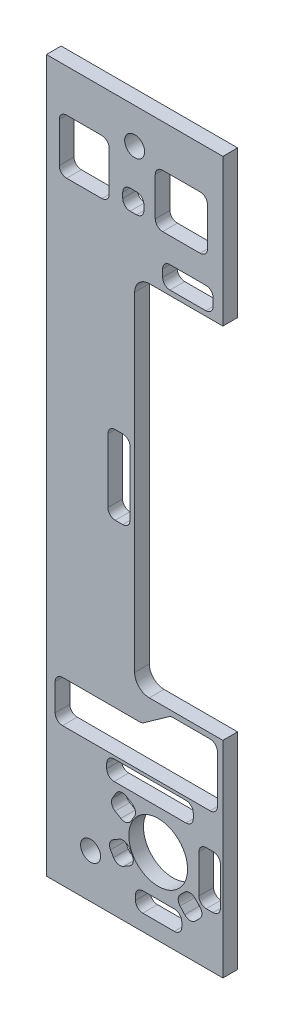
from build123d import *

# Parameters (mm, degrees)
BOSS_EXTRUDE1_DEPTH        = 3.175
F_6_CLEARANCE_HOLE1_D      = 4.3053
F_1_2_0_5_DIAMETER_HOLE1_D = 12.7
CUT_EXTRUDE1_DEPTH         = 159.354537431


with BuildPart() as part:
    # Sketch1 → Boss-Extrude1 (new body)
    with BuildSketch(Plane.XY):
        with BuildLine():
            Line((0, 0), (0, 44.45))
            Line((0, 44.45), (-15.875, 44.45))
            ThreePointArc((-15.875, 44.45), (-18.12006403, 45.37993597), (-19.05, 47.625))
            Line((-19.05, 47.625), (-19.05, 118.745))
            ThreePointArc((-19.05, 118.745), (-18.12006403, 120.99006403), (-15.875, 121.92))
            Line((-15.875, 121.92), (0, 121.92))
            Line((0, 121.92), (0, 153.67))
            Line((0, 153.67), (-38.1, 153.67))
            Line((-38.1, 153.67), (-38.1, 0))
            Line((-38.1, 0), (0, 0))
        make_face()
    extrude(amount=BOSS_EXTRUDE1_DEPTH)

    # #6 Clearance Hole1 (through all)
    with Locations(Plane(origin=(0, 0, 0), x_dir=(-1, 0, 0), z_dir=(0, 0, -1))):
        with Locations((28.575, 9.525), (19.05, 146.05)):
            Hole(F_6_CLEARANCE_HOLE1_D / 2)

    # 1/2 (0.5) Diameter Hole1 (through all)
    with Locations(Plane(origin=(0, 0, 0), x_dir=(-1, 0, 0), z_dir=(0, 0, -1))):
        with Locations((13.97, 16.51)):
            Hole(F_1_2_0_5_DIAMETER_HOLE1_D / 2)

    # Sketch6 → Cut-Extrude1 (cut, through all)
    with BuildSketch(Plane(origin=(0, 0, 0), x_dir=(-1, 0, 0), z_dir=(0, 0, -1))):
        with BuildLine():
            Line((2.086095691, 126.12437394), (2.086095691, 124.54355915))
            ThreePointArc((2.086095691, 124.54355915), (2.551063676, 123.421027135), (3.673595691, 122.95605915))
            Line((3.673595691, 122.95605915), (11.415583391, 122.95605915))
            ThreePointArc((11.415583391, 122.95605915), (12.538115406, 123.421027135), (13.003083391, 124.54355915))
            Line((13.003083391, 124.54355915), (13.003083391, 126.12437394))
            ThreePointArc((13.003083391, 126.12437394), (12.538115406, 127.246905955), (11.415583391, 127.71187394))
            Line((11.415583391, 127.71187394), (3.673595691, 127.71187394))
            ThreePointArc((3.673595691, 127.71187394), (2.551063676, 127.246905955), (2.086095691, 126.12437394))
        make_face()
        with BuildLine():
            Line((20.033703278, 89.369187567), (20.033703278, 75.581424323))
            ThreePointArc((20.033703278, 75.581424323), (20.498671263, 74.458892308), (21.621203278, 73.993924323))
            Line((21.621203278, 73.993924323), (23.241936694, 73.993924323))
            ThreePointArc((23.241936694, 73.993924323), (24.364468709, 74.458892308), (24.829436694, 75.581424323))
            Line((24.829436694, 75.581424323), (24.829436694, 89.369187567))
            ThreePointArc((24.829436694, 89.369187567), (24.364468709, 90.491719582), (23.241936694, 90.956687567))
            Line((23.241936694, 90.956687567), (21.621203278, 90.956687567))
            ThreePointArc((21.621203278, 90.956687567), (20.498671263, 90.491719582), (20.033703278, 89.369187567))
        make_face()
        with BuildLine():
            Line((2.759594469, 43.321454641), (10.76708766, 43.321454641))
            ThreePointArc((10.76708766, 43.321454641), (11.250343379, 43.246112093), (11.687728589, 43.027235945))
            Line((11.687728589, 43.027235945), (17.051636407, 39.208860888))
            ThreePointArc((17.051636407, 39.208860888), (17.489021617, 38.98998474), (17.972277336, 38.914642192))
            Line((17.972277336, 38.914642192), (34.627683239, 38.914642192))
            ThreePointArc((34.627683239, 38.914642192), (35.750215254, 38.449674207), (36.215183239, 37.327142192))
            Line((36.215183239, 37.327142192), (36.215183239, 31.47925594))
            ThreePointArc((36.215183239, 31.47925594), (35.750215254, 30.356723925), (34.627683239, 29.89175594))
            Line((34.627683239, 29.89175594), (2.759594469, 29.89175594))
            ThreePointArc((2.759594469, 29.89175594), (1.637062454, 30.356723925), (1.172094469, 31.47925594))
            Line((1.172094469, 31.47925594), (1.172094469, 41.733954641))
            ThreePointArc((1.172094469, 41.733954641), (1.637062454, 42.856486656), (2.759594469, 43.321454641))
        make_face()
        with BuildLine():
            Line((23.496317308, 29.23518518), (7.981217757, 29.23518518))
            ThreePointArc((7.981217757, 29.23518518), (6.858685741, 28.770217195), (6.393717757, 27.64768518))
            Line((6.393717757, 27.64768518), (6.393717757, 26.597597051))
            ThreePointArc((6.393717757, 26.597597051), (6.858685741, 25.475065036), (7.981217757, 25.010097051))
            Line((7.981217757, 25.010097051), (23.496317308, 25.010097051))
            ThreePointArc((23.496317308, 25.010097051), (24.618849324, 25.475065036), (25.083817308, 26.597597051))
            Line((25.083817308, 26.597597051), (25.083817308, 27.64768518))
            ThreePointArc((25.083817308, 27.64768518), (24.618849324, 28.770217195), (23.496317308, 29.23518518))
        make_face()
        with BuildLine():
            Line((2.113882863, 22.586241269), (3.592384956, 22.586241269))
            ThreePointArc((3.592384956, 22.586241269), (4.714916971, 22.121273284), (5.179884956, 20.998741269))
            Line((5.179884956, 20.998741269), (5.179884956, 12.755613209))
            ThreePointArc((5.179884956, 12.755613209), (4.714916971, 11.633081194), (3.592384956, 11.168113209))
            Line((3.592384956, 11.168113209), (2.113882863, 11.168113209))
            ThreePointArc((2.113882863, 11.168113209), (0.991350848, 11.633081194), (0.526382863, 12.755613209))
            Line((0.526382863, 12.755613209), (0.526382863, 20.998741269))
            ThreePointArc((0.526382863, 20.998741269), (0.991350848, 22.121273284), (2.113882863, 22.586241269))
        make_face()
        with BuildLine():
            Line((18.879806488, 6.08183183), (18.879806488, 5.073926227))
            ThreePointArc((18.879806488, 5.073926227), (18.414838503, 3.951394212), (17.292306488, 3.486426227))
            Line((17.292306488, 3.486426227), (10.463932238, 3.486426227))
            ThreePointArc((10.463932238, 3.486426227), (9.341400223, 3.951394212), (8.876432238, 5.073926227))
            Line((8.876432238, 5.073926227), (8.876432238, 6.08183183))
            ThreePointArc((8.876432238, 6.08183183), (9.341400223, 7.204363845), (10.463932238, 7.66933183))
            Line((10.463932238, 7.66933183), (17.292306488, 7.66933183))
            ThreePointArc((17.292306488, 7.66933183), (18.414838503, 7.204363845), (18.879806488, 6.08183183))
        make_face()
        with BuildLine():
            Line((6.030987626, 11.925319997), (4.983176412, 10.877508783))
            ThreePointArc((4.983176412, 10.877508783), (4.518208427, 9.754976767), (4.983176412, 8.632444752))
            Line((4.983176412, 8.632444752), (5.943333194, 7.67228797))
            ThreePointArc((5.943333194, 7.67228797), (7.110275776, 7.207941303), (8.249421661, 7.736826424))
            Line((8.249421661, 7.736826424), (9.238538577, 8.843331936))
            ThreePointArc((9.238538577, 8.843331936), (9.641860808, 9.945736065), (9.177514141, 11.023857513))
            Line((9.177514141, 11.023857513), (8.276051657, 11.925319997))
            ThreePointArc((8.276051657, 11.925319997), (7.153519641, 12.390287982), (6.030987626, 11.925319997))
        make_face()
        with BuildLine():
            Line((20.203743496, 14.211835085), (19.550583224, 13.090409141))
            ThreePointArc((19.550583224, 13.090409141), (19.387406634, 11.88639637), (20.123388956, 10.919647502))
            Line((20.123388956, 10.919647502), (21.439156716, 10.153295312))
            ThreePointArc((21.439156716, 10.153295312), (22.643169487, 9.990118723), (23.609918355, 10.726101045))
            Line((23.609918355, 10.726101045), (24.263078627, 11.847526988))
            ThreePointArc((24.263078627, 11.847526988), (24.426255216, 13.051539759), (23.690272894, 14.018288627))
            Line((23.690272894, 14.018288627), (22.374505134, 14.784640817))
            ThreePointArc((22.374505134, 14.784640817), (21.170492364, 14.947817407), (20.203743496, 14.211835085))
        make_face()
        with BuildLine():
            Line((19.098011702, 20.675012055), (19.85485139, 19.39515307))
            ThreePointArc((19.85485139, 19.39515307), (20.826455949, 18.665592974), (22.029361012, 18.836744254))
            Line((22.029361012, 18.836744254), (23.273160379, 19.572260226))
            ThreePointArc((23.273160379, 19.572260226), (24.002720475, 20.543864785), (23.831569194, 21.746769848))
            Line((23.831569194, 21.746769848), (23.074729506, 23.026628833))
            ThreePointArc((23.074729506, 23.026628833), (22.103124948, 23.756188929), (20.900219884, 23.585037649))
            Line((20.900219884, 23.585037649), (19.656420517, 22.849521677))
            ThreePointArc((19.656420517, 22.849521677), (18.926860421, 21.877917118), (19.098011702, 20.675012055))
        make_face()
        with BuildLine():
            Line((4.907288518, 144.565417771), (13.015464629, 144.565417771))
            ThreePointArc((13.015464629, 144.565417771), (14.137996644, 144.100449786), (14.602964629, 142.977917771))
            Line((14.602964629, 142.977917771), (14.602964629, 134.67957577))
            ThreePointArc((14.602964629, 134.67957577), (14.137996644, 133.557043755), (13.015464629, 133.09207577))
            Line((13.015464629, 133.09207577), (4.907288518, 133.09207577))
            ThreePointArc((4.907288518, 133.09207577), (3.784756502, 133.557043755), (3.319788518, 134.67957577))
            Line((3.319788518, 134.67957577), (3.319788518, 142.977917771))
            ThreePointArc((3.319788518, 142.977917771), (3.784756502, 144.100449786), (4.907288518, 144.565417771))
        make_face()
        with BuildLine():
            Line((18.639136407, 137.719445748), (20.033703278, 137.719445748))
            ThreePointArc((20.033703278, 137.719445748), (21.156235293, 137.254477763), (21.621203278, 136.131945748))
            Line((21.621203278, 136.131945748), (21.621203278, 134.996518919))
            ThreePointArc((21.621203278, 134.996518919), (21.156235293, 133.873986904), (20.033703278, 133.409018919))
            Line((20.033703278, 133.409018919), (18.639136407, 133.409018919))
            ThreePointArc((18.639136407, 133.409018919), (17.516604392, 133.873986904), (17.051636407, 134.996518919))
            Line((17.051636407, 134.996518919), (17.051636407, 136.131945748))
            ThreePointArc((17.051636407, 136.131945748), (17.516604392, 137.254477763), (18.639136407, 137.719445748))
        make_face()
        with BuildLine():
            Line((26.142479513, 144.502029141), (33.743546585, 144.502029141))
            ThreePointArc((33.743546585, 144.502029141), (34.8660786, 144.037061156), (35.331046585, 142.914529141))
            Line((35.331046585, 142.914529141), (35.331046585, 134.299243991))
            ThreePointArc((35.331046585, 134.299243991), (34.8660786, 133.176711976), (33.743546585, 132.711743991))
            Line((33.743546585, 132.711743991), (26.142479513, 132.711743991))
            ThreePointArc((26.142479513, 132.711743991), (25.019947498, 133.176711976), (24.554979513, 134.299243991))
            Line((24.554979513, 134.299243991), (24.554979513, 142.914529141))
            ThreePointArc((24.554979513, 142.914529141), (25.019947498, 144.037061156), (26.142479513, 144.502029141))
        make_face()
    extrude(amount=-CUT_EXTRUDE1_DEPTH, mode=Mode.SUBTRACT)


solid = part.part
